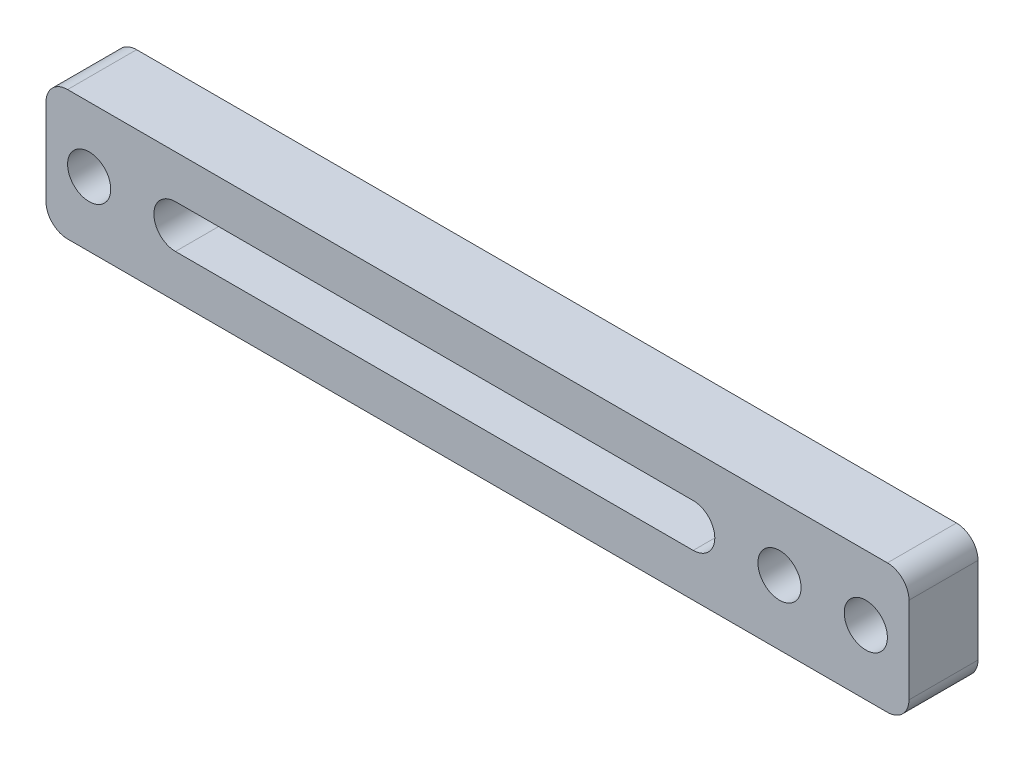
from build123d import *

# Parameters (mm, degrees)
SKETCH_1_W          = 100
SKETCH_1_H          = 15
EXTRUDE_1_DEPTH     = 8
SKETCH_2_R          = 2.5
CUT_EXTRUDE_2_DEPTH = 8
FILLET_2_R          = 2.5


with BuildPart() as part:
    # Эскиз1 → Вытянуть1 (new body)
    with BuildSketch(Plane.XY):
        with Locations((50, 7.5)):
            Rectangle(SKETCH_1_W, SKETCH_1_H)
    extrude(amount=EXTRUDE_1_DEPTH)

    # Эскиз2 → Вытянуть2 (cut)
    with BuildSketch(Plane.XY.offset(8)):
        with Locations((5, 7.5)):
            Circle(SKETCH_2_R)
        with Locations((95, 7.5)):
            Circle(SKETCH_2_R)
        with Locations((85, 7.5)):
            Circle(SKETCH_2_R)
        with BuildLine():
            Line((15, 10), (75, 10))
            ThreePointArc((75, 10), (77.5, 7.5), (75, 5))
            Line((75, 5), (15, 5))
            ThreePointArc((15, 5), (12.5, 7.5), (15, 10))
        make_face()
    extrude(amount=-CUT_EXTRUDE_2_DEPTH, mode=Mode.SUBTRACT)

    # Скругление2
    fillet_2_edges = [part.edges().sort_by_distance(p)[0] for p in [
        (0, 0, 4),
        (0, 15, 4),
        (100, 0, 4),
        (100, 15, 4),
    ]]
    fillet(fillet_2_edges, radius=FILLET_2_R)


solid = part.part
